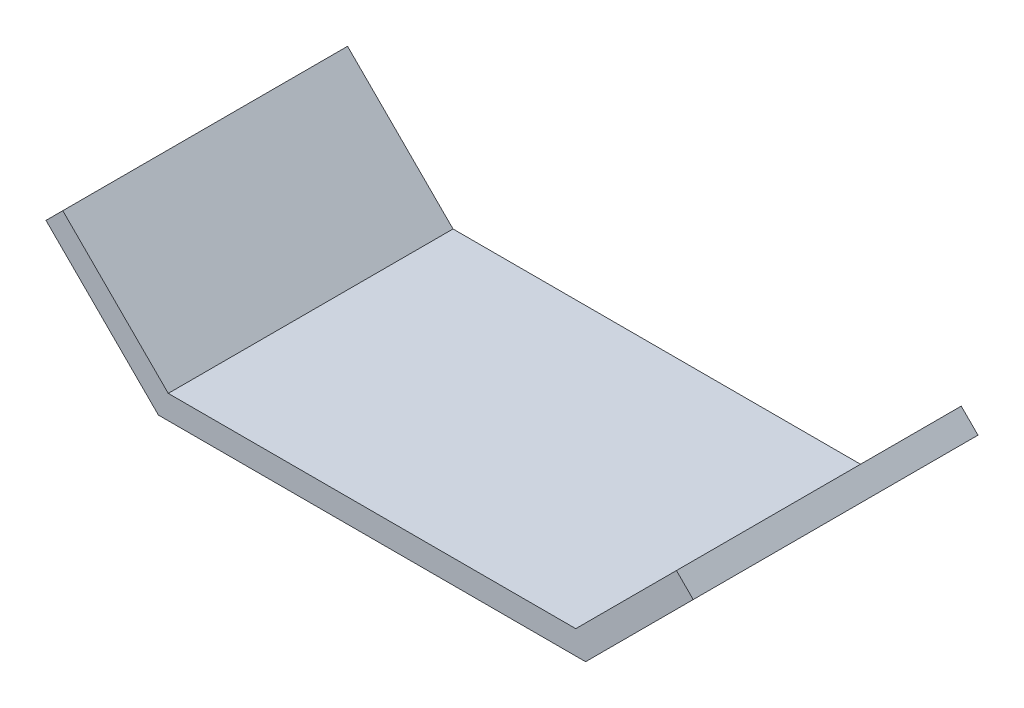
from build123d import *

# Parameters (mm, degrees)
EXTRUDE_1_DEPTH = 30


with BuildPart() as part:
    # 草图1 → 凸台-拉伸1 (new, symmetric)
    with BuildSketch(Plane.XY):
        Polygon((42.928932188, 2.5), (-42.928932188, 2.5), (-65.152379383, 24.723447195), (-68.687913289, 21.187913289), (-45, -2.5), (45, -2.5), (67.67766953, 20.17766953), (64.142135624, 23.713203436), align=None)
    extrude(amount=EXTRUDE_1_DEPTH, both=True)


solid = part.part
